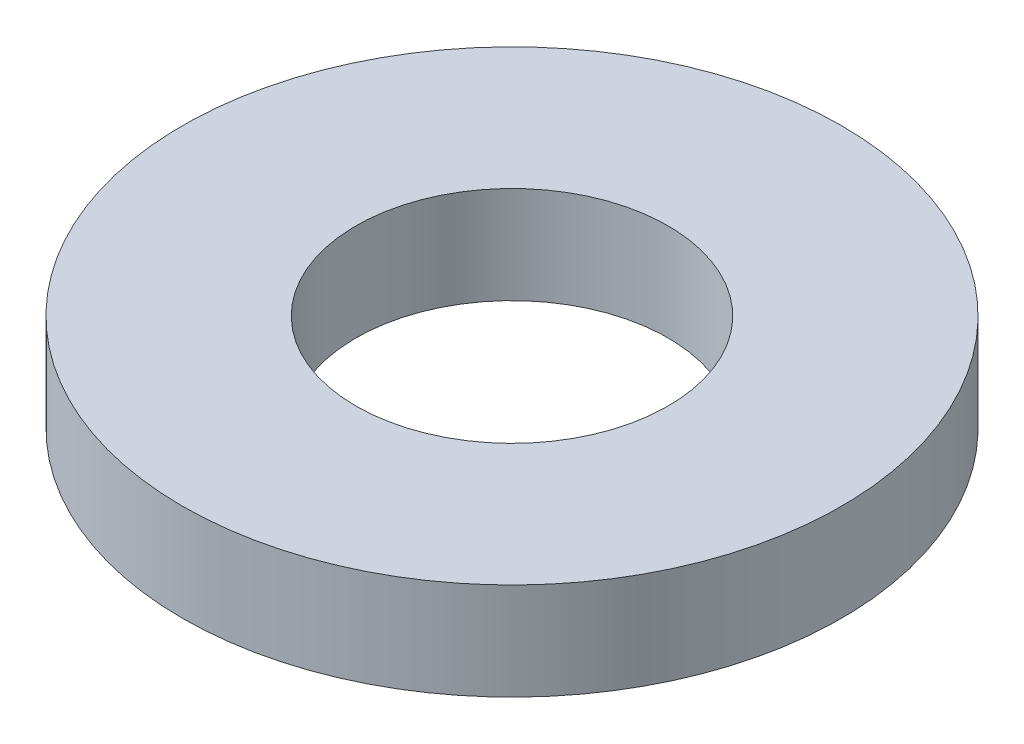
from build123d import *

# Parameters (mm, degrees)
SKETCH1_R           = 47.5
BOSS_EXTRUDE1_DEPTH = 14
SKETCH2_R           = 22.5
CUT_EXTRUDE1_DEPTH  = 69.618510622


with BuildPart() as part:
    # Sketch1 → Boss-Extrude1 (new body)
    with BuildSketch(Plane(origin=(0, 0, 0), x_dir=(1, 0, 0), z_dir=(0, 1, 0))):
        Circle(SKETCH1_R)
    extrude(amount=BOSS_EXTRUDE1_DEPTH)

    # Sketch2 → Cut-Extrude1 (cut, through all)
    with BuildSketch(Plane(origin=(0, 0, 0), x_dir=(1, 0, 0), z_dir=(0, 1, 0))):
        Circle(SKETCH2_R)
    extrude(amount=CUT_EXTRUDE1_DEPTH, mode=Mode.SUBTRACT)


solid = part.part
